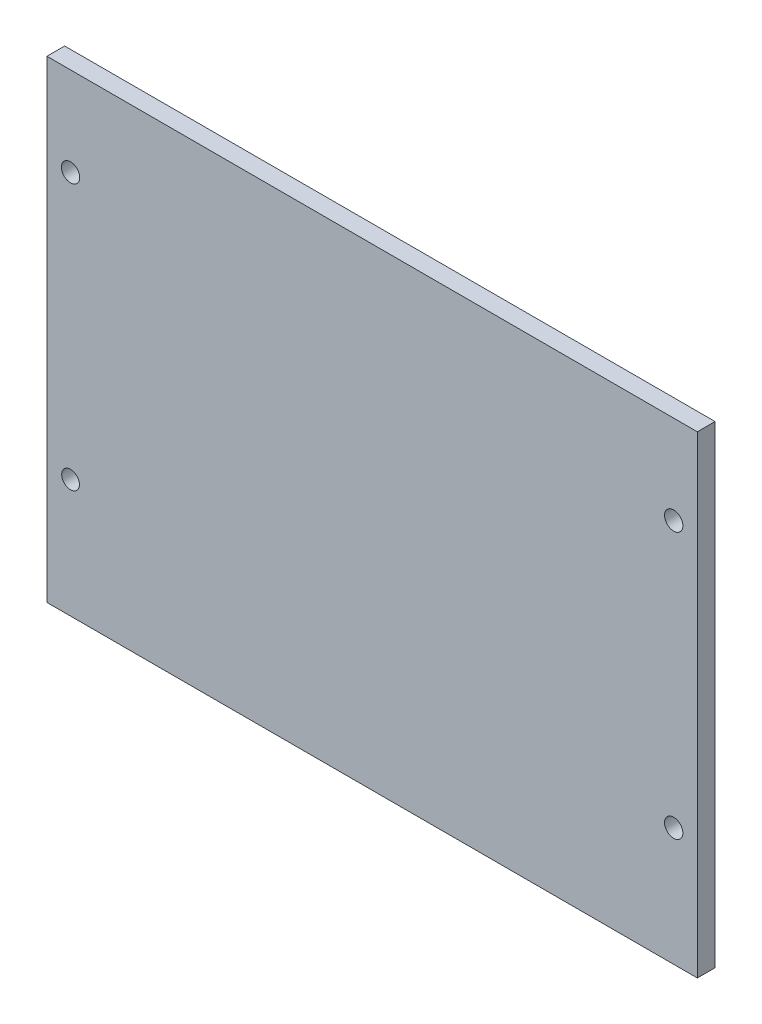
from build123d import *

# Parameters (mm, degrees)
SKETCH_1_W          = 110
SKETCH_1_H          = 80
EXTRUDE_1_DEPTH     = 3
SKETCH_2_R          = 1.55
SKETCH_2_R_2        = 1.5
CUT_EXTRUDE_1_DEPTH = 10


with BuildPart() as part:
    # 草图1 → 凸台-拉伸1 (new body)
    with BuildSketch(Plane.XY):
        Rectangle(SKETCH_1_W, SKETCH_1_H)
    extrude(amount=EXTRUDE_1_DEPTH)

    # 草图2 → 切除-拉伸1 (cut)
    with BuildSketch(Plane.XY.offset(3)):
        with Locations((51, 25)):
            Circle(SKETCH_2_R)
        with Locations((51, -20)):
            Circle(SKETCH_2_R)
        with Locations((-51, 25)):
            Circle(SKETCH_2_R)
        with Locations((-51, -20)):
            Circle(SKETCH_2_R_2)
    extrude(amount=-CUT_EXTRUDE_1_DEPTH, mode=Mode.SUBTRACT)


solid = part.part
